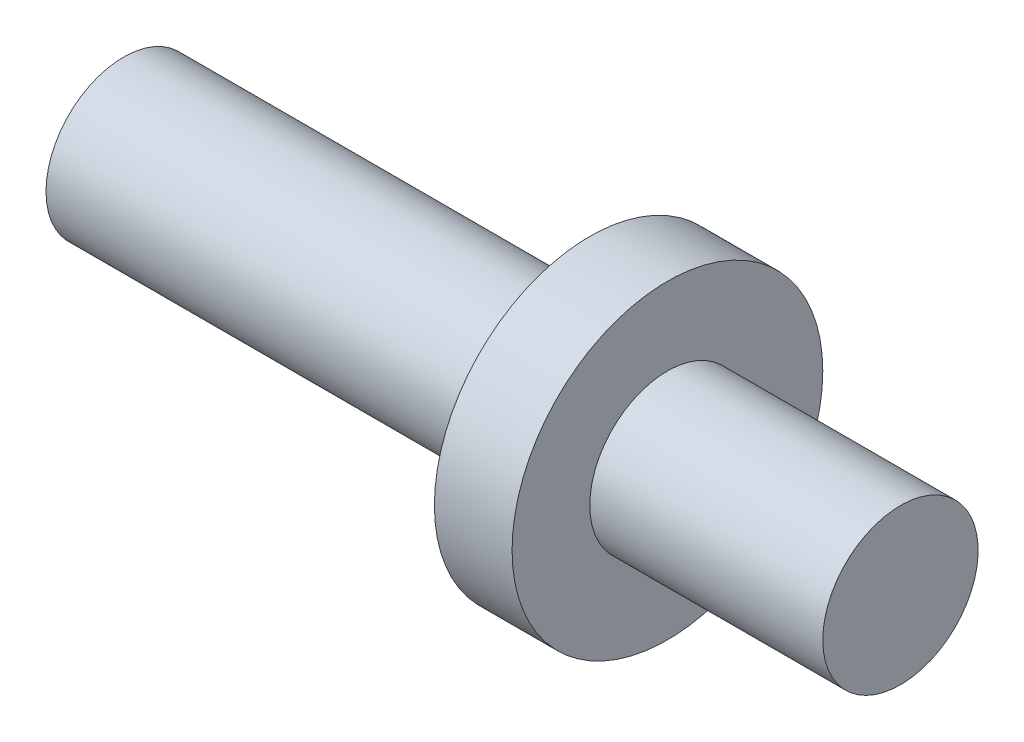
from build123d import *


with BuildPart() as part:
    # Sketch1 → Revolve1 (revolve)
    with BuildSketch(Plane.XY):
        Polygon((0, 0), (12.7, 0), (12.7, 3.175), (3.175, 3.175), (3.175, 6.35), (0, 6.35), (0, 3.175), (-19.05, 3.175), (-19.05, 0), align=None)
    revolve(axis=Axis((-19.05, 0, 0), (1, 0, 0)))


solid = part.part
